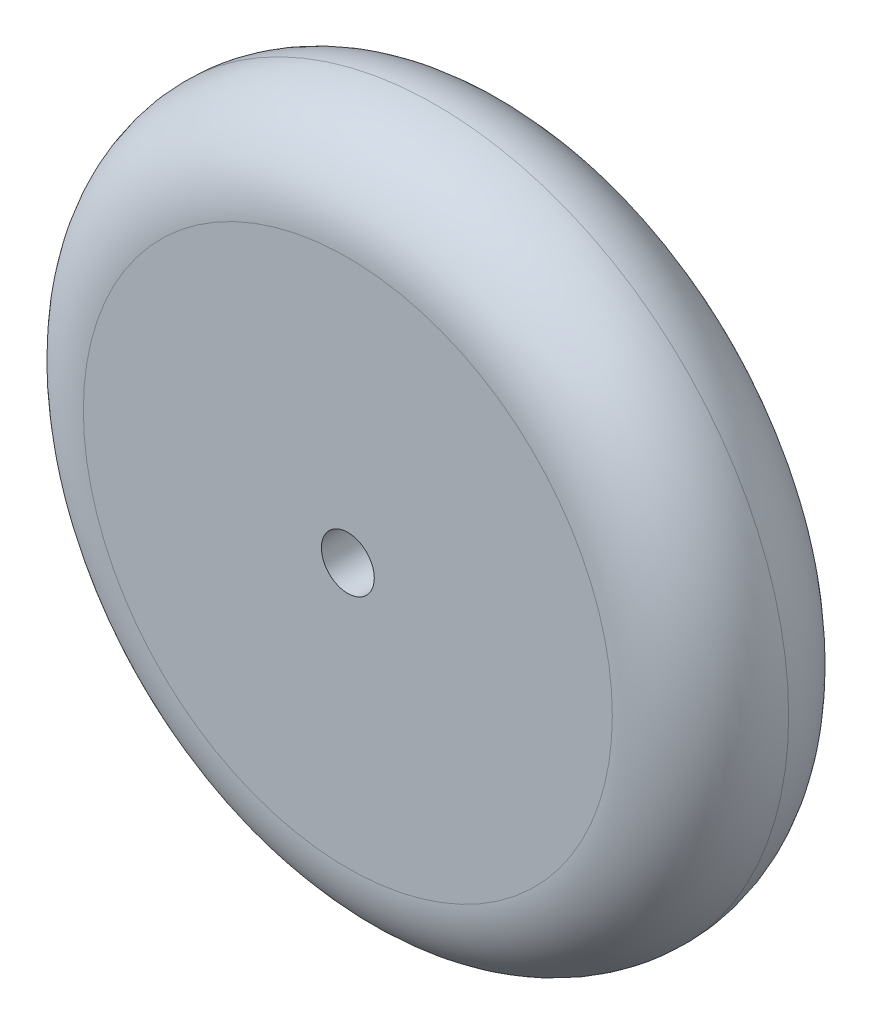
from build123d import *

# Parameters (mm, degrees)
SKETCH1_R           = 20
BOSS_EXTRUDE1_DEPTH = 10
FILLET1_R           = 5
FILLET2_R           = 5
SKETCH2_R           = 1.5
CUT_EXTRUDE1_DEPTH  = 31.000000133


with BuildPart() as part:
    # Sketch1 → Boss-Extrude1 (new body)
    with BuildSketch(Plane.XY):
        Circle(SKETCH1_R)
    extrude(amount=BOSS_EXTRUDE1_DEPTH)

    # Fillet1
    fillet1_edges = [part.edges().sort_by_distance(p)[0] for p in [
        (-20, 0, 10),
    ]]
    fillet(fillet1_edges, radius=FILLET1_R)

    # Fillet2
    fillet2_edges = [part.edges().sort_by_distance(p)[0] for p in [
        (-20, 0, 0),
    ]]
    fillet(fillet2_edges, radius=FILLET2_R - 0.0001)  # a hair under: the kernel refuses the full size

    # Sketch2 → Cut-Extrude1 (cut, through all)
    with BuildSketch(Plane.XY.offset(10)):
        Circle(SKETCH2_R)
    extrude(amount=-CUT_EXTRUDE1_DEPTH, mode=Mode.SUBTRACT)


solid = part.part
